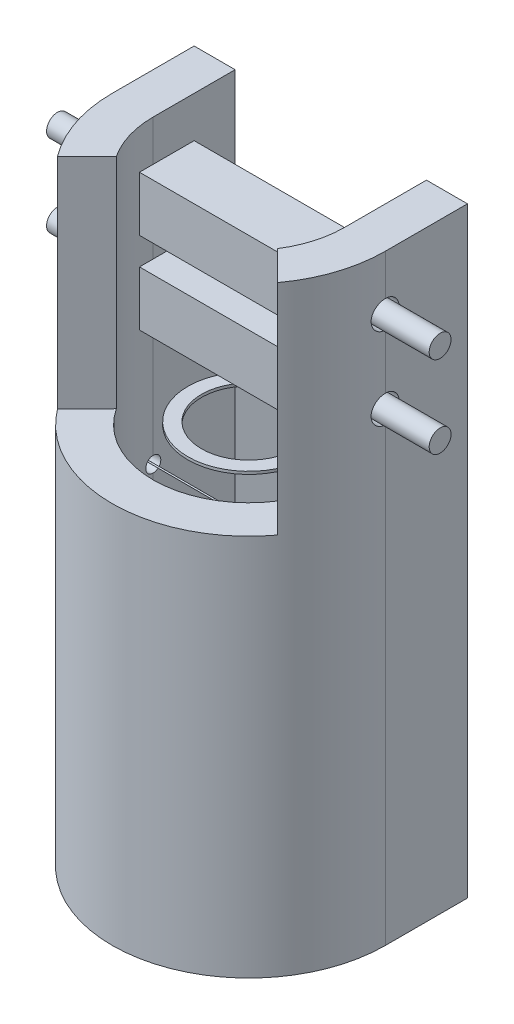
from build123d import *

# Parameters (mm, degrees)
SKETCH1_R                  = 22.3
SKETCH1_R_2                = 17.3
BOSS_EXTRUDE1_DEPTH        = 1
BOSS_EXTRUDE5_DEPTH        = 80
BOSS_EXTRUDE5_DEPTH_BACK   = 140
BOSS_EXTRUDE6_DEPTH        = 140
CUT_EXTRUDE1_DEPTH         = 80
CUT_EXTRUDE1_DEPTH_BACK    = 10
SKETCH6_R                  = 2.8
BOSS_EXTRUDE7_DEPTH        = 80
BOSS_EXTRUDE7_DEPTH_BACK   = 10
SKETCH10_R                 = 0.25
SKETCH11_R                 = 5
CUT_EXTRUDE2_DEPTH         = 500
CUT_EXTRUDE3_DEPTH         = 80
BOSS_EXTRUDE8_DEPTH        = 20
BOSS_EXTRUDE8_DEPTH_BACK   = 20
SKETCH12_R                 = 4
BOSS_EXTRUDE8_2_DEPTH      = 20
BOSS_EXTRUDE8_2_DEPTH_BACK = 20
BOSS_EXTRUDE9_DEPTH        = 20
BOSS_EXTRUDE9_DEPTH_BACK   = 20
SKETCH14_R                 = 4
BOSS_EXTRUDE9_2_DEPTH      = 20
BOSS_EXTRUDE9_2_DEPTH_BACK = 20
SKETCH15_W                 = 20
SKETCH15_H                 = 20
BOSS_EXTRUDE10_DEPTH       = 60


with BuildPart() as part:
    # Sketch1 → Boss-Extrude1 (new body)
    with BuildSketch(Plane(origin=(0, 0, 0), x_dir=(1, 0, 0), z_dir=(0, 1, 0))):
        Circle(SKETCH1_R)
        Circle(SKETCH1_R_2, mode=Mode.SUBTRACT)
    extrude(amount=BOSS_EXTRUDE1_DEPTH)


with BuildPart() as body_2:
    # Sketch3 → Boss-Extrude5 (new, two sides: drawn at the far end of the back side and taken through both)
    with BuildSketch(Plane(origin=(0, 0, 0), x_dir=(1, 0, 0), z_dir=(0, 1, 0)).offset(-BOSS_EXTRUDE5_DEPTH_BACK)):
        with BuildLine():
            Line((-50, 30), (-50, 0))
            ThreePointArc((-50, 0), (0, -50), (50, 0))
            Line((50, 0), (50, 30))
            Line((50, 30), (35, 30))
            Line((35, 30), (35, 0))
            ThreePointArc((35, 0), (0, -35), (-35, 0))
            Line((-35, 0), (-35, 30))
            Line((-35, 30), (-50, 30))
        make_face()
    extrude(amount=BOSS_EXTRUDE5_DEPTH + BOSS_EXTRUDE5_DEPTH_BACK)

    # Sketch3<10> → Boss-Extrude6 (add)
    with BuildSketch(Plane(origin=(0, 0, 0), x_dir=(1, 0, 0), z_dir=(0, 1, 0))):
        Polygon((-35, 40), (-50, 30), (-35, 30), (-20, 40), align=None)
        Polygon((35, 30), (50, 30), (35, 40), (20, 40), align=None)
    extrude(amount=-BOSS_EXTRUDE6_DEPTH)

    # Sketch6 → Cut-Extrude1 (cut, two sides: drawn at the far end of the back side and taken through both)
    with BuildSketch(Plane(origin=(-35, 0, 0), x_dir=(0, 0, -1), z_dir=(1, 0, 0)).offset(-CUT_EXTRUDE1_DEPTH_BACK)):
        with Locations((0, -30)):
            Circle(SKETCH6_R)
        with Locations((0, -130)):
            Circle(SKETCH6_R)
    extrude(amount=CUT_EXTRUDE1_DEPTH + CUT_EXTRUDE1_DEPTH_BACK, mode=Mode.SUBTRACT)

    # Sketch10 → Boss-Extrude7 (add, two sides: drawn at the far end of the back side and taken through both)
    with BuildSketch(Plane.ZY.offset(-35).offset(-BOSS_EXTRUDE7_DEPTH_BACK)):
        with Locations((0, -30)):
            Circle(SKETCH10_R)
        with Locations((0, -130)):
            Circle(SKETCH10_R)
    extrude(amount=BOSS_EXTRUDE7_DEPTH + BOSS_EXTRUDE7_DEPTH_BACK)

    # Sketch11 → Cut-Extrude2 (cut, symmetric)
    with BuildSketch(Plane(origin=(0, 0, 0), x_dir=(0, 0, -1), z_dir=(1, 0, 0))):
        with Locations((0, 60)):
            Circle(SKETCH11_R)
        with Locations((0, 30)):
            Circle(SKETCH11_R)
    extrude(amount=CUT_EXTRUDE2_DEPTH, both=True, mode=Mode.SUBTRACT)

    # Sketch13 → Cut-Extrude3 (cut)
    with BuildSketch(Plane(origin=(0, 80, 0), x_dir=(1, 0, 0), z_dir=(0, 1, 0))):
        with BuildLine():
            Line((-29.285714286, -19.16629695), (-40, -30))
            ThreePointArc((-40, -30), (0.15588625, -49.999756994), (40.186284974, -29.75))
            Line((40.186284974, -29.75), (29.421869313, -18.956624334))
            ThreePointArc((29.421869313, -18.956624334), (0.125000797, -34.999776782), (-29.285714286, -19.16629695))
        make_face()
    extrude(amount=-CUT_EXTRUDE3_DEPTH, mode=Mode.SUBTRACT)


with BuildPart() as body_3:
    # Sketch12 → Boss-Extrude8 (new, two sides: drawn at the far end of the back side and taken through both)
    with BuildSketch(Plane(origin=(50, 0, 0), x_dir=(0, 0, -1), z_dir=(1, 0, 0)).offset(-BOSS_EXTRUDE8_DEPTH_BACK)):
        with Locations((0, 30)):
            Circle(SKETCH12_R)
    extrude(amount=BOSS_EXTRUDE8_DEPTH + BOSS_EXTRUDE8_DEPTH_BACK)



with BuildPart() as body_4:
    # Sketch12 → Boss-Extrude8 2 (new, two sides: drawn at the far end of the back side and taken through both)
    with BuildSketch(Plane(origin=(50, 0, 0), x_dir=(0, 0, -1), z_dir=(1, 0, 0)).offset(-BOSS_EXTRUDE8_2_DEPTH_BACK)):
        with Locations((0, 60)):
            Circle(SKETCH12_R)
    extrude(amount=BOSS_EXTRUDE8_2_DEPTH + BOSS_EXTRUDE8_2_DEPTH_BACK)


with BuildPart() as body_5:
    # Sketch14 → Boss-Extrude9 (new, two sides: drawn at the far end of the back side and taken through both)
    with BuildSketch(Plane.ZY.offset(50).offset(-BOSS_EXTRUDE9_DEPTH_BACK)):
        with Locations((0, 60)):
            Circle(SKETCH14_R)
    extrude(amount=BOSS_EXTRUDE9_DEPTH + BOSS_EXTRUDE9_DEPTH_BACK)


with BuildPart() as body_6:
    # Sketch14 → Boss-Extrude9 2 (new, two sides: drawn at the far end of the back side and taken through both)
    with BuildSketch(Plane.ZY.offset(50).offset(-BOSS_EXTRUDE9_2_DEPTH_BACK)):
        with Locations((0, 30)):
            Circle(SKETCH14_R)
    extrude(amount=BOSS_EXTRUDE9_2_DEPTH + BOSS_EXTRUDE9_2_DEPTH_BACK)


with BuildPart() as body_3_1:
    add(body_3.part)

    add(body_4.part)  # Boss-Extrude10 merges body 4

    add(body_5.part)  # Boss-Extrude10 merges body 5

    add(body_6.part)  # Boss-Extrude10 merges body 6
    # Sketch15 → Boss-Extrude10 (add)
    with BuildSketch(Plane(origin=(-30, 0, 0), x_dir=(0, 0, -1), z_dir=(1, 0, 0))):
        with Locations((0, 60)):
            Rectangle(SKETCH15_W, SKETCH15_H)
        with Locations((0, 30)):
            Rectangle(SKETCH15_W, SKETCH15_H)
    extrude(amount=BOSS_EXTRUDE10_DEPTH)


solid = Compound([part.part, body_2.part, body_3_1.part])
